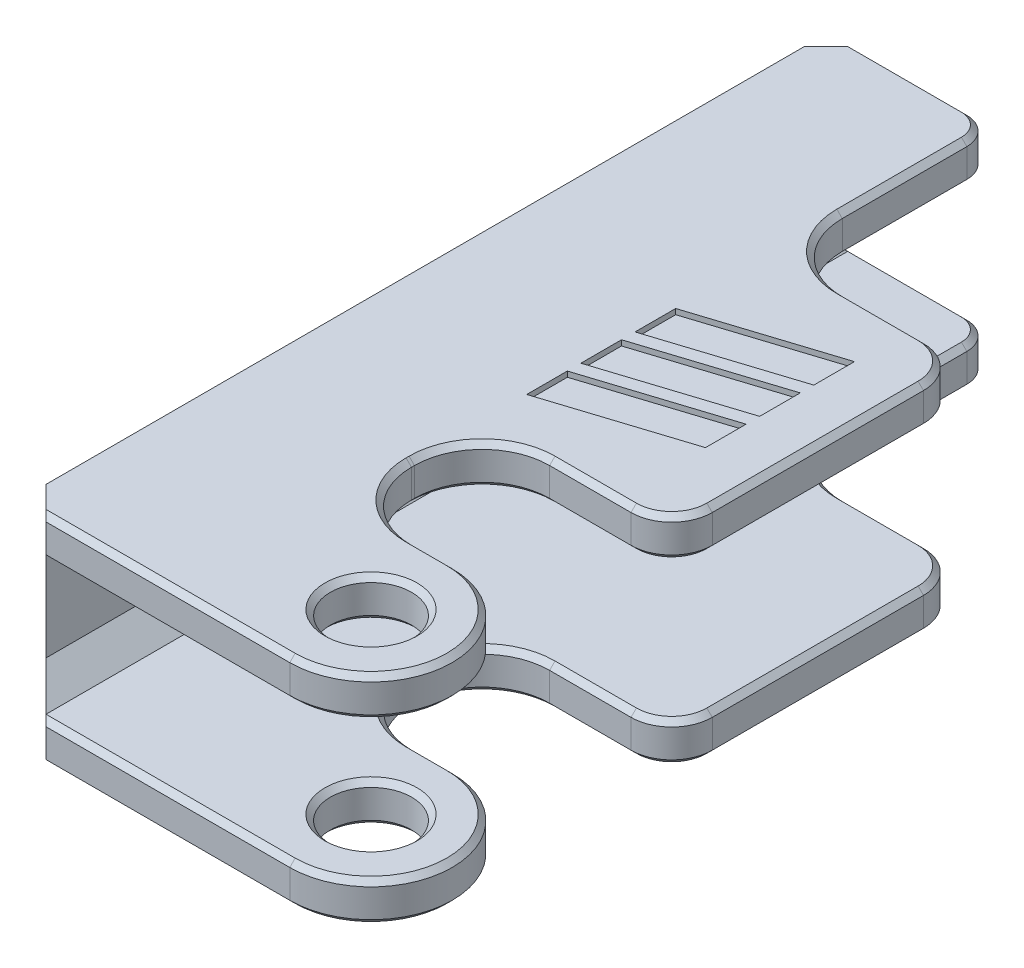
from build123d import *

# Parameters (mm, degrees)
SKETCH_1_W          = 29
SKETCH_1_H          = 60
EXTRUDE_1_DEPTH     = 16
SKETCH_2_W          = 26.2
SKETCH_2_H          = 10.2
CUT_EXTRUDE_1_DEPTH = 69.534662763
SKETCH_3_R          = 3
CUT_EXTRUDE_2_DEPTH = 69.534662763
CUT_EXTRUDE_3_DEPTH = 69.534662763
CUT_EXTRUDE_4_DEPTH = 69.534662763
CUT_EXTRUDE_5_DEPTH = 69.534662763
FILLET_1_R          = 3
CHAMFER_1_SIZE      = 5
CHAMFER_3_SIZE      = 3
CHAMFER_4_SIZE      = 1.8
FILLET_2_R          = 2
CHAMFER_2_SIZE      = 0.4
CUT_EXTRUDE_6_DEPTH = 0.4


with BuildPart() as part:
    # 草图1 → 凸台-拉伸1 (new body)
    with BuildSketch(Plane(origin=(0, 0, 0), x_dir=(1, 0, 0), z_dir=(0, 1, 0))):
        with Locations((14.5, 30)):
            Rectangle(SKETCH_1_W, SKETCH_1_H)
    extrude(amount=EXTRUDE_1_DEPTH)

    # 草图2 → 切除-拉伸1 (cut, through all)
    with BuildSketch(Plane(origin=(0, 0, -60), x_dir=(-1, 0, 0), z_dir=(0, 0, -1))):
        with Locations((-15.9, 8)):
            Rectangle(SKETCH_2_W, SKETCH_2_H)
    extrude(amount=-CUT_EXTRUDE_1_DEPTH, mode=Mode.SUBTRACT)

    # 草图3 → 切除-拉伸2 (cut, through all)
    with BuildSketch(Plane(origin=(0, 0, 0), x_dir=(-1, 0, 0), z_dir=(0, -1, 0))):
        with Locations(Location((-23, 6, 0), (0, 0, 90))):
            Circle(SKETCH_3_R)
    extrude(amount=-CUT_EXTRUDE_2_DEPTH, mode=Mode.SUBTRACT)

    # 草图4 → 切除-拉伸3 (cut, through all)
    with BuildSketch(Plane(origin=(0, 16, 0), x_dir=(1, 0, 0), z_dir=(0, 1, 0))):
        with BuildLine():
            Line((23, 0), (24.972936344, -1.282691022))
            Line((24.972936344, -1.282691022), (32.744307438, -1.586182692))
            Line((32.744307438, -1.586182692), (32.104431406, 9.686424342))
            Line((32.104431406, 9.686424342), (29.958145659, 12))
            Line((29.958145659, 12), (23, 12))
            ThreePointArc((23, 12), (29, 6), (23, 0))
        make_face()
    extrude(amount=-CUT_EXTRUDE_3_DEPTH, mode=Mode.SUBTRACT)

    # 草图5 → 切除-拉伸4 (cut, through all)
    with BuildSketch(Plane(origin=(0, 16, 0), x_dir=(1, 0, 0), z_dir=(0, 1, 0))):
        with BuildLine():
            Line((29, 12), (19.99, 12))
            ThreePointArc((19.99, 12), (16.461537162, 13.461537162), (15, 16.99))
            Line((15, 16.99), (15, 17.21))
            ThreePointArc((15, 17.21), (16.461537162, 20.738462838), (19.99, 22.2))
            Line((19.99, 22.2), (29, 22.2))
            Line((29, 22.2), (29, 12))
        make_face()
    extrude(amount=-CUT_EXTRUDE_4_DEPTH, mode=Mode.SUBTRACT)

    # 草图6 → 切除-拉伸5 (cut, through all)
    with BuildSketch(Plane(origin=(0, 16, 0), x_dir=(1, 0, 0), z_dir=(0, 1, 0))):
        with BuildLine():
            Line((29, 60), (15, 60))
            Line((15, 60), (15, 48.8))
            ThreePointArc((15, 48.8), (16.464466094, 45.264466094), (20, 43.8))
            Line((20, 43.8), (29, 43.8))
            Line((29, 43.8), (29, 60))
        make_face()
    extrude(amount=-CUT_EXTRUDE_5_DEPTH, mode=Mode.SUBTRACT)

    # 圆角1
    fillet_1_edges = [part.edges().sort_by_distance(p)[0] for p in [
        (29, 14.55, -43.8),
        (29, 1.45, -43.8),
        (29, 14.55, -22.2),
        (29, 1.45, -22.2),
    ]]
    fillet(fillet_1_edges, radius=FILLET_1_R)

    # 倒角1
    # the kernel refuses this chamfer: 5 mm, written as the material it takes off along each edge
    with BuildSketch(Plane(origin=(0, -12.85841494, -60), x_dir=(0.9996219169112968, 0, -0.027495876610586317), z_dir=(0, 1, 0)), Plane(origin=(0, -12.85841494, 0), x_dir=(-0.027495876610586372, 0, -0.9996219169112968), z_dir=(0, 1, 0))) as chamfer_1_piece_1:
        Polygon((CHAMFER_1_SIZE * 0.999621916911, -CHAMFER_1_SIZE * 0.0274958766106), (-CHAMFER_1_SIZE * 0.0274958766106, -CHAMFER_1_SIZE * 0.999621916911), (0, 0), align=None)
    extrude(amount=41.71682988, mode=Mode.SUBTRACT)

    # 倒角3
    chamfer_3_edges = [part.edges().sort_by_distance(p)[0] for p in [
        (0, 0, -30),
        (0, 16, -30),
    ]]
    chamfer(chamfer_3_edges, length=CHAMFER_3_SIZE)

    # 倒角4
    chamfer_4_edges = [part.edges().sort_by_distance(p)[0] for p in [
        (2.8, 13.1, -30),
        (2.8, 2.9, -30),
    ]]
    chamfer(chamfer_4_edges, length=CHAMFER_4_SIZE)

    # 圆角2
    fillet_2_edges = [part.edges().sort_by_distance(p)[0] for p in [
        (15, 14.55, -60),
        (15, 1.45, -60),
    ]]
    fillet(fillet_2_edges, radius=FILLET_2_R)

    # 倒角2
    chamfer_2_edges = [part.edges().sort_by_distance(p)[0] for p in [
        (23, 0, -3),
        (29, 0, -6),
        (21.495, 0, -12),
        (16.461537162, 0, -13.461537162),
        (15, 0, -17.1),
        (16.461537162, 0, -20.738462838),
        (22.995, 0, -22.2),
        (28.121320344, 0, -23.078679656),
        (29, 0, -33),
        (28.121320344, 0, -42.921320344),
        (23, 0, -43.8),
        (16.464466094, 0, -45.264466094),
        (15, 0, -53.4),
        (9, 0, -60),
        (14, 0, 0),
        (29, 13.1, -6),
        (21.495, 13.1, -12),
        (16.461537162, 13.1, -13.461537162),
        (15, 13.1, -17.1),
        (16.461537162, 13.1, -20.738462838),
        (22.995, 13.1, -22.2),
        (28.121320344, 13.1, -23.078679656),
        (29, 13.1, -33),
        (28.121320344, 13.1, -42.921320344),
        (23, 13.1, -43.8),
        (16.464466094, 13.1, -45.264466094),
        (15, 13.1, -53.4),
        (9, 13.1, -60),
        (14, 13.1, 0),
        (23, 13.1, -3),
        (9, 2.9, -60),
        (15, 2.9, -53.4),
        (16.464466094, 2.9, -45.264466094),
        (23, 2.9, -43.8),
        (28.121320344, 2.9, -42.921320344),
        (29, 2.9, -33),
        (28.121320344, 2.9, -23.078679656),
        (22.995, 2.9, -22.2),
        (16.461537162, 2.9, -20.738462838),
        (15, 2.9, -17.1),
        (16.461537162, 2.9, -13.461537162),
        (21.495, 2.9, -12),
        (29, 2.9, -6),
        (14, 2.9, 0),
        (23, 2.9, -3),
        (9, 16, -60),
        (15, 16, -53.4),
        (16.464466094, 16, -45.264466094),
        (23, 16, -43.8),
        (28.121320344, 16, -42.921320344),
        (29, 16, -33),
        (28.121320344, 16, -23.078679656),
        (22.995, 16, -22.2),
        (16.461537162, 16, -20.738462838),
        (15, 16, -17.1),
        (16.461537162, 16, -13.461537162),
        (21.495, 16, -12),
        (29, 16, -6),
        (14, 16, 0),
        (23, 16, -3),
        (14.414213562, 0, -59.414213562),
        (14.414213562, 13.1, -59.414213562),
        (14.414213562, 2.9, -59.414213562),
        (14.414213562, 16, -59.414213562),
    ]]
    chamfer(chamfer_2_edges, length=CHAMFER_2_SIZE)

    # 草图7 → 切除-拉伸6 (cut)
    with BuildSketch(Plane(origin=(0, 16, 0), x_dir=(1, 0, 0), z_dir=(0, 1, 0))):
        Polygon((25, 28.7), (15, 25.498437881), (15, 28.498437881), (25, 31.7), align=None)
        Polygon((25, 32.7), (15, 29.498437881), (15, 32.498437881), (25, 35.7), align=None)
        Polygon((25, 36.7), (15, 33.498437881), (15, 36.498437881), (25, 39.7), align=None)
    cut_extrude_6 = extrude(amount=-CUT_EXTRUDE_6_DEPTH, mode=Mode.SUBTRACT)

    # 镜向1: 切除-拉伸6 across plane
    add(cut_extrude_6.mirror(Plane.ZX.offset(8)), mode=Mode.SUBTRACT)


solid = part.part
